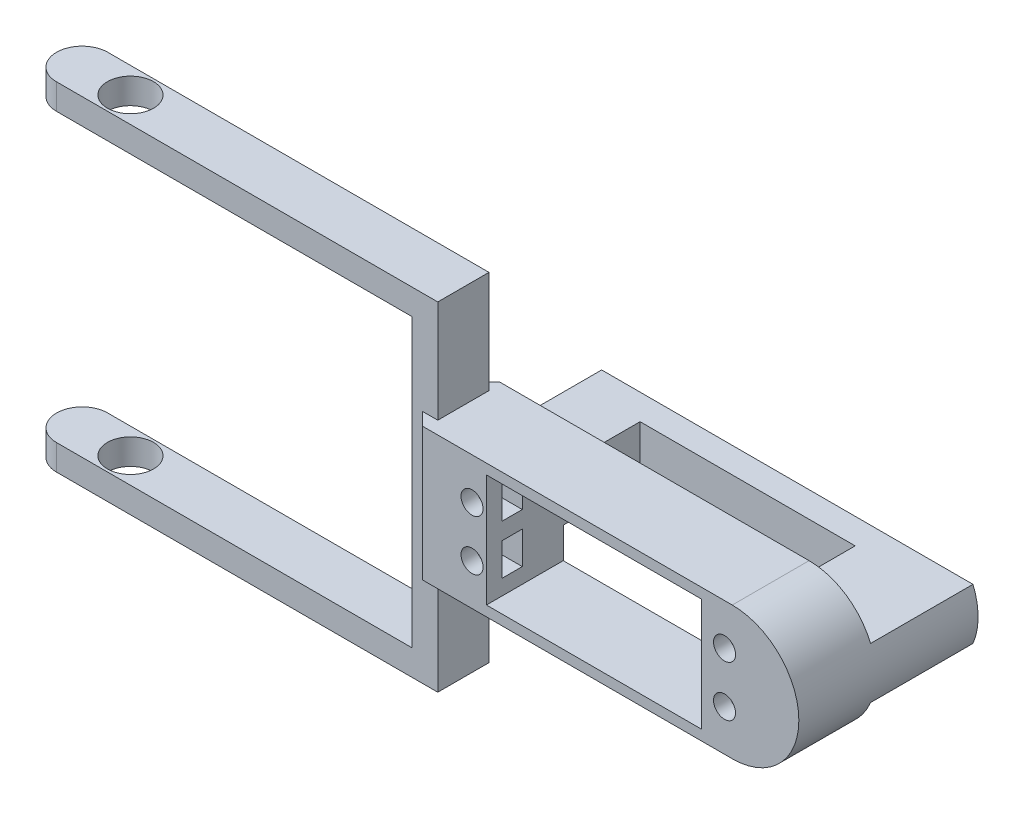
from build123d import *

# Parameters (mm, degrees)
BOSS_EXTRU_1_DEPTH      = 15
ESQUISSE2_W             = 42
ESQUISSE2_H             = 22
ENL_V_MAT_EXTRU_1_DEPTH = 48.360320945
ESQUISSE4_R             = 2.15
ENL_V_MAT_EXTRU_2_DEPTH = 3
ESQUISSE5_W             = 4
ESQUISSE5_H             = 6.35
ENL_V_MAT_EXTRU_3_DEPTH = 6
ESQUISSE6_W             = 4
ESQUISSE6_H             = 6.35
ENL_V_MAT_EXTRU_4_DEPTH = 8
BOSS_EXTRU_2_DEPTH      = 5
BOSS_EXTRU_2_DEPTH_BACK = 5
CHANFREIN1_SIZE         = 3
BOSS_EXTRU_4_DEPTH      = 5
BOSS_EXTRU_6_START      = 20
ESQUISSE13_W            = 12.5
ESQUISSE13_H            = 10
BOSS_EXTRU_6_DEPTH      = 20
ESQUISSE14_W            = 42
ESQUISSE14_H            = 10
BOSS_EXTRU_7_DEPTH      = 5
BOSS_EXTRU_8_START      = -5
BOSS_EXTRU_8_DEPTH      = 5
ESQUISSE17_R            = 4.5
ENL_V_MAT_EXTRU_5_DEPTH = 130.352109985


with BuildPart() as part:
    # Esquisse1 → Boss.-Extru.1 (new body)
    with BuildSketch(Plane.XY):
        with BuildLine():
            Line((30, -13), (-30, -13))
            Line((-30, -13), (-30, 13))
            Line((-30, 13), (30, 13))
            ThreePointArc((30, 13), (43, 0), (30, -13))
        make_face()
    extrude(amount=BOSS_EXTRU_1_DEPTH)

    # Esquisse2 → Enlèv. mat.-Extru.1 (cut, through all)
    with BuildSketch(Plane.XY.offset(15)):
        with Locations((3, 0)):
            Rectangle(ESQUISSE2_W, ESQUISSE2_H)
    extrude(amount=-ENL_V_MAT_EXTRU_1_DEPTH, mode=Mode.SUBTRACT)

    # Esquisse4 → Enlèv. mat.-Extru.2 (cut)
    with BuildSketch(Plane.XY.offset(15)):
        with Locations((-20.81, 4.935)):
            Circle(ESQUISSE4_R)
        with Locations((-20.81, -4.935)):
            Circle(ESQUISSE4_R)
        with Locations((28.49, 4.935)):
            Circle(ESQUISSE4_R)
        with Locations((28.49, -4.935)):
            Circle(ESQUISSE4_R)
    extrude(amount=-ENL_V_MAT_EXTRU_2_DEPTH, mode=Mode.SUBTRACT)

    # Esquisse5 → Enlèv. mat.-Extru.3 (cut)
    with BuildSketch(Plane(origin=(-18, 0, 0), x_dir=(0, 0, -1), z_dir=(1, 0, 0))):
        with Locations((-10, -4.825)):
            Rectangle(ESQUISSE5_W, ESQUISSE5_H)
        with Locations((-10, 4.825)):
            Rectangle(ESQUISSE5_W, ESQUISSE5_H)
    extrude(amount=-ENL_V_MAT_EXTRU_3_DEPTH, mode=Mode.SUBTRACT)

    # Esquisse6 → Enlèv. mat.-Extru.4 (cut)
    with BuildSketch(Plane.ZY.offset(-24)):
        with Locations((10, 4.825)):
            Rectangle(ESQUISSE6_W, ESQUISSE6_H)
        with Locations((10, -4.825)):
            Rectangle(ESQUISSE6_W, ESQUISSE6_H)
    extrude(amount=-ENL_V_MAT_EXTRU_4_DEPTH, mode=Mode.SUBTRACT)

    # Esquisse9 → Boss.-Extru.2 (add, two sides: drawn at the far end of the back side and taken through both)
    with BuildSketch(Plane.XY.offset(7.5).offset(-BOSS_EXTRU_2_DEPTH_BACK)):
        Polygon((-30, -33), (-30, 33), (-95, 33), (-95, 28), (-35, 28), (-35, -28), (-95, -28), (-95, -33), align=None)
    extrude(amount=BOSS_EXTRU_2_DEPTH + BOSS_EXTRU_2_DEPTH_BACK)

    # Chanfrein1
    # the kernel refuses this chamfer: 3 mm, written as the material it adds along each edge
    with BuildSketch(Plane(origin=(-30, -13, 12.5), x_dir=(0.02749587661058678, 0, 0.9996219169112968), z_dir=(0, 1, 0))) as chanfrein1_piece_1_section:
        Polygon((CHANFREIN1_SIZE * 0.999621916911, -CHANFREIN1_SIZE * 0.0274958766106), (-CHANFREIN1_SIZE * 0.0274958766106, -CHANFREIN1_SIZE * 0.999621916911), (0, 0), align=None)
    chanfrein1_piece_1 = extrude(amount=26, mode=Mode.PRIVATE)
    chanfrein1_piece_1 = split(chanfrein1_piece_1, bisect_by=Plane(origin=(-31.023809524, 0, 15), z_dir=(0, 0, -1)), keep=Keep.TOP, mode=Mode.PRIVATE)
    add(chanfrein1_piece_1)
    with BuildSketch(Plane(origin=(-30, -13, 2.5), x_dir=(0.027495876610586778, 0, -0.9996219169112968), z_dir=(0, 1, 0))) as chanfrein1_piece_2_section:
        Polygon((CHANFREIN1_SIZE * 0.999621916911, CHANFREIN1_SIZE * 0.0274958766106), (-CHANFREIN1_SIZE * 0.0274958766106, CHANFREIN1_SIZE * 0.999621916911), (0, 0), align=None)
    chanfrein1_piece_2 = extrude(amount=26, mode=Mode.PRIVATE)
    chanfrein1_piece_2 = split(chanfrein1_piece_2, bisect_by=Plane(origin=(-31.023809524, 0, 0), z_dir=(0, 0, 1)), keep=Keep.TOP, mode=Mode.PRIVATE)
    add(chanfrein1_piece_2)

    # Esquisse11 → Boss.-Extru.4 (add)
    with BuildSketch(Plane.XZ.offset(33)):
        with BuildLine():
            Line((-95, 2.5), (-95, 12.5))
            Line((-95, 12.5), (-104.43476759, 12.5))
            ThreePointArc((-104.43476759, 12.5), (-109.43476759, 7.5), (-104.43476759, 2.5))
            Line((-104.43476759, 2.5), (-95, 2.5))
        make_face()
    extrude(amount=-BOSS_EXTRU_4_DEPTH)

    # Esquisse13 → Boss.-Extru.6 (add)
    with BuildSketch(Plane(origin=(0, 0, 0), x_dir=(-1, 0, 0), z_dir=(0, 0, -1)).offset(BOSS_EXTRU_6_START)):
        with BuildLine():
            Line((-24, -5), (-24, 5))
            Line((-24, 5), (-42, 5))
            ThreePointArc((-42, 5), (-43, 0), (-42, -5))
            Line((-42, -5), (-24, -5))
        make_face()
        with Locations((24.25, 0)):
            Rectangle(ESQUISSE13_W, ESQUISSE13_H)
    extrude(amount=-BOSS_EXTRU_6_DEPTH)

    # Esquisse14 → Boss.-Extru.7 (add)
    with BuildSketch(Plane(origin=(0, 0, -20), x_dir=(-1, 0, 0), z_dir=(0, 0, -1))):
        with Locations((-3, 0)):
            Rectangle(ESQUISSE14_W, ESQUISSE14_H)
    extrude(amount=-BOSS_EXTRU_7_DEPTH)

    # Esquisse16 → Boss.-Extru.8 (add)
    with BuildSketch(Plane(origin=(0, 33, 0), x_dir=(1, 0, 0), z_dir=(0, 1, 0)).offset(BOSS_EXTRU_8_START)):
        with BuildLine():
            Line((-89.416041875, -12.5), (-104.43476759, -12.5))
            ThreePointArc((-104.43476759, -12.5), (-109.43476759, -7.5), (-104.43476759, -2.5))
            Line((-104.43476759, -2.5), (-89.416041875, -2.5))
            Line((-89.416041875, -2.5), (-89.416041875, -12.5))
        make_face()
    extrude(amount=BOSS_EXTRU_8_DEPTH)

    # Esquisse17 → Enlèv. mat.-Extru.5 (cut, through all)
    with BuildSketch(Plane.XZ.offset(33)):
        with Locations((-95, 7.5)):
            Circle(ESQUISSE17_R)
    extrude(amount=-ENL_V_MAT_EXTRU_5_DEPTH, mode=Mode.SUBTRACT)


solid = part.part
